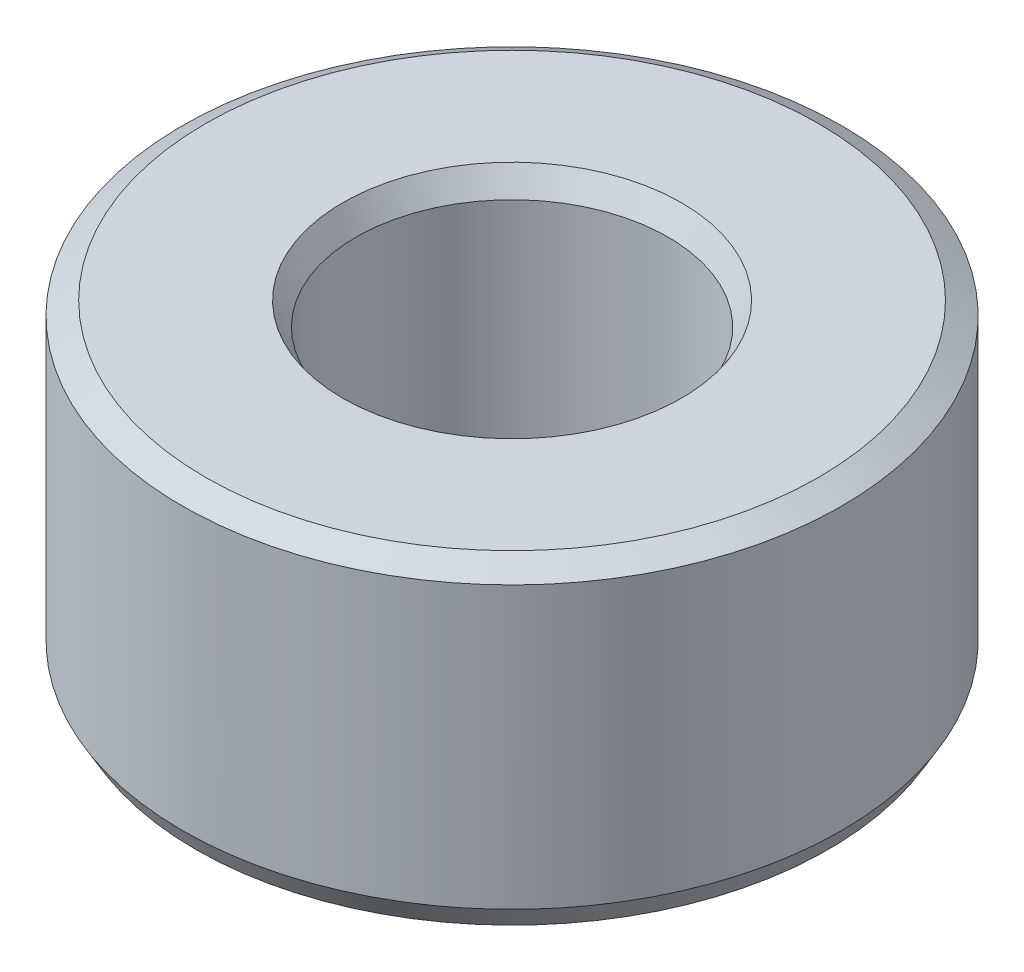
from build123d import *
from OCP.BRepFilletAPI import BRepFilletAPI_MakeChamfer

# Parameters (mm, degrees)
SKETCH1_R           = 17.5
BOSS_EXTRUDE1_DEPTH = 16.853769528
SKETCH2_R           = 8.285884339
CUT_EXTRUDE1_DEPTH  = 30.942437231
CHAMFER1_SIZE       = 0.708081975
CHAMFER1_SIZE2      = 1.226433957


with BuildPart() as part:
    # Sketch1 → Boss-Extrude1 (new body)
    with BuildSketch(Plane(origin=(0, 0, 0), x_dir=(1, 0, 0), z_dir=(0, 1, 0))):
        Circle(SKETCH1_R)
    extrude(amount=BOSS_EXTRUDE1_DEPTH)

    # Sketch2 → Cut-Extrude1 (cut, through all)
    with BuildSketch(Plane(origin=(0, 0, 0), x_dir=(1, 0, 0), z_dir=(0, 1, 0))):
        Circle(SKETCH2_R)
    extrude(amount=CUT_EXTRUDE1_DEPTH, mode=Mode.SUBTRACT)

    # Chamfer1: one chamfer whose edges measure the first distance from different faces: ONE call of the kernel's chamfer builder (chamfer() names one face for all edges)
    chamfer1_edges_1 = [part.edges().sort_by_distance(p)[0] for p in [
        (-8.285884339, 16.853769528, 0),
    ]]
    chamfer1_side_1 = [part.faces().sort_by_distance(p)[0] for p in [
        (-17.005025253, 16.853769528, 0),
    ]]
    chamfer1_edges_2 = [part.edges().sort_by_distance(p)[0] for p in [
        (-8.285884339, 0, 0),
    ]]
    chamfer1_side_2 = [part.faces().sort_by_distance(p)[0] for p in [
        (-8.285884339, 8.426884764, 0),
    ]]
    chamfer1_edges_3 = [part.edges().sort_by_distance(p)[0] for p in [
        (-17.5, 0, 0),
    ]]
    chamfer1_side_3 = [part.faces().sort_by_distance(p)[0] for p in [
        (-17.005025253, 0, 0),
    ]]
    chamfer1_edges_4 = [part.edges().sort_by_distance(p)[0] for p in [
        (-17.5, 16.853769528, 0),
    ]]
    chamfer1_side_4 = [part.faces().sort_by_distance(p)[0] for p in [
        (-17.5, 8.426884764, 0),
    ]]
    chamfer1 = BRepFilletAPI_MakeChamfer(part.part.solid().wrapped)
    for e in chamfer1_edges_1:
        chamfer1.Add(CHAMFER1_SIZE, CHAMFER1_SIZE2, e.wrapped, chamfer1_side_1[0].wrapped)  # the first distance lies on this face
    for e in chamfer1_edges_2:
        chamfer1.Add(CHAMFER1_SIZE, CHAMFER1_SIZE2, e.wrapped, chamfer1_side_2[0].wrapped)  # the first distance lies on this face
    for e in chamfer1_edges_3:
        chamfer1.Add(CHAMFER1_SIZE, CHAMFER1_SIZE2, e.wrapped, chamfer1_side_3[0].wrapped)  # the first distance lies on this face
    for e in chamfer1_edges_4:
        chamfer1.Add(CHAMFER1_SIZE, CHAMFER1_SIZE2, e.wrapped, chamfer1_side_4[0].wrapped)  # the first distance lies on this face
    add(Compound.cast(chamfer1.Shape()), mode=Mode.REPLACE)


solid = part.part
